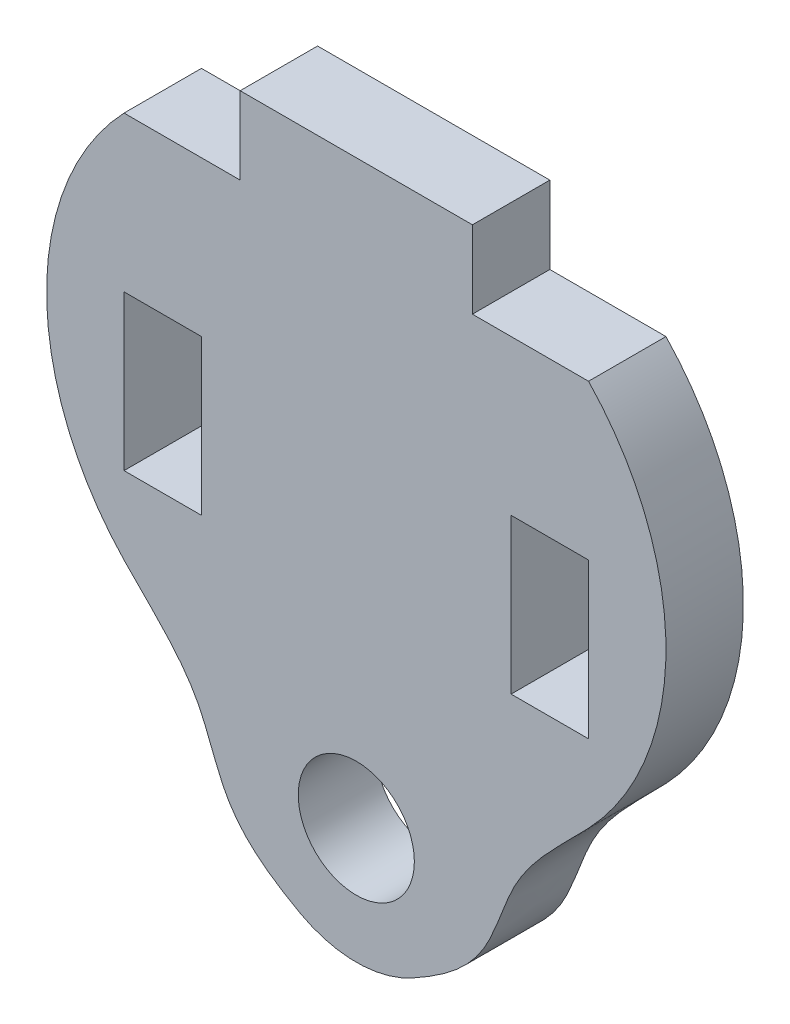
from build123d import *

# Parameters (mm, degrees)
SKETCH1_W           = 9.525
SKETCH1_H           = 3.175
SKETCH1_R           = 2.38125
BOSS_EXTRUDE1_DEPTH = 3.175
CAVITY1_START       = -9.525
CAVITY1_OUTLINE_W   = 6.35
CAVITY1_OUTLINE_H   = 3.175
CAVITY1_DEPTH       = 3.175
CAVITY1_START_2     = 6.35
CAVITY1_2_OUTLINE_W = 6.35
CAVITY1_2_OUTLINE_H = 3.175
CAVITY1_2_DEPTH     = 3.175


# Read off the part's stored shape, not the designer's step: Cavity1
with BuildPart() as part:
    # Sketch1 → Boss-Extrude1 (new body)
    # profile 1 of 10: a face of its own
    with BuildSketch(Plane.XY):
        with BuildLine():
            ThreePointArc((-9.525, 7.9375), (-11.876811414, 4.274474566), (-12.7, 0))
            Line((-12.7, 0), (-9.525, 0))
            Line((-9.525, 0), (-9.525, 7.9375))
        make_face()
    # profile 2 of 10: a face of its own
    with BuildSketch(Plane.XY):
        with BuildLine():
            Line((-9.525, 0), (-12.7, 0))
            ThreePointArc((-12.7, 0), (-11.876811414, -4.274474566), (-9.525, -7.9375))
            Line((-9.525, -7.9375), (-9.525, 0))
        make_face()
    # profile 3 of 10: a face of its own
    with BuildSketch(Plane.XY):
        Polygon((-9.525, 7.9375), (-9.525, 0), (0, 0), (9.525, 0), (9.525, 7.9375), (4.7625, 7.9375), (-4.7625, 7.9375), align=None)
    # profile 4 of 10: a face of its own
    with BuildSketch(Plane.XY):
        Polygon((0, 0), (-9.525, 0), (-9.525, -7.9375), (0, -7.9375), (9.525, -7.9375), (9.525, 0), align=None)
    # profile 5 of 10: a face of its own
    with BuildSketch(Plane.XY):
        with BuildLine():
            Line((0, -7.9375), (-9.525, -7.9375))
            add(Edge.make_bspline(
                [(-9.525, -7.9375), (-8.354743729, -9.166269084), (-6.479229503, -10.75772626), (-5.396989703, -14.77189499), (-3.721125314, -16.086113374), (-2.300921541, -16.869792119)],
                knots=[0, 0, 0, 0, 0.40377748, 0.653864755, 1, 1, 1, 1], degree=3))
            ThreePointArc((-2.300921541, -16.869792119), (-4.611943257, -11.511982474), (0, -7.9375))
        make_face()
    # profile 6 of 10: a face of its own
    with BuildSketch(Plane.XY):
        with Locations((0, 9.525)):
            Rectangle(SKETCH1_W, SKETCH1_H)
    # profile 7 of 10: a face of its own
    with BuildSketch(Plane.XY):
        with BuildLine():
            Line((9.525, -7.9375), (0, -7.9375))
            ThreePointArc((0, -7.9375), (3.367596045, -9.332403955), (4.7625, -12.7))
            ThreePointArc((4.7625, -12.7), (4.1011916, -15.121081103), (2.300921541, -16.869792119))
            add(Edge.make_bspline(
                [(9.525, -7.9375), (8.354743729, -9.166269084), (6.479229503, -10.75772626), (5.396989703, -14.77189499), (3.721125314, -16.086113374), (2.300921541, -16.869792119)],
                knots=[0, 0, 0, 0, 0.40377748, 0.653864755, 1, 1, 1, 1], degree=3))
        make_face()
    # profile 8 of 10: a face of its own
    with BuildSketch(Plane.XY):
        with BuildLine():
            ThreePointArc((4.7625, -12.7), (3.367596045, -9.332403955), (0, -7.9375))
            ThreePointArc((0, -7.9375), (-4.611943257, -11.511982474), (-2.300921541, -16.869792119))
            ThreePointArc((-2.300921541, -16.869792119), (0, -17.4625), (2.300921541, -16.869792119))
            ThreePointArc((2.300921541, -16.869792119), (4.1011916, -15.121081103), (4.7625, -12.7))
        make_face()
        with Locations((0, -12.7)):
            Circle(SKETCH1_R, mode=Mode.SUBTRACT)
    # profile 9 of 10: a face of its own
    with BuildSketch(Plane.XY):
        with BuildLine():
            Line((9.525, 7.9375), (9.525, 0))
            Line((9.525, 0), (12.7, 0))
            ThreePointArc((12.7, 0), (11.876811414, 4.274474566), (9.525, 7.9375))
        make_face()
    # profile 10 of 10: a face of its own
    with BuildSketch(Plane.XY):
        with BuildLine():
            Line((12.7, 0), (9.525, 0))
            Line((9.525, 0), (9.525, -7.9375))
            ThreePointArc((9.525, -7.9375), (11.876811414, -4.274474566), (12.7, 0))
        make_face()
    extrude(amount=BOSS_EXTRUDE1_DEPTH)

    # Cavity1 outline → Cavity1 (cut)
    with BuildSketch(Plane.YZ.offset(CAVITY1_START)):
        with Locations((-1.5875, 1.5875)):
            Rectangle(CAVITY1_OUTLINE_W, CAVITY1_OUTLINE_H)
    extrude(amount=CAVITY1_DEPTH, mode=Mode.SUBTRACT)

    # Cavity1 2 outline → Cavity1 2 (cut)
    with BuildSketch(Plane.YZ.offset(CAVITY1_START_2)):
        with Locations((-1.5875, 1.5875)):
            Rectangle(CAVITY1_2_OUTLINE_W, CAVITY1_2_OUTLINE_H)
    extrude(amount=CAVITY1_2_DEPTH, mode=Mode.SUBTRACT)


solid = part.part
